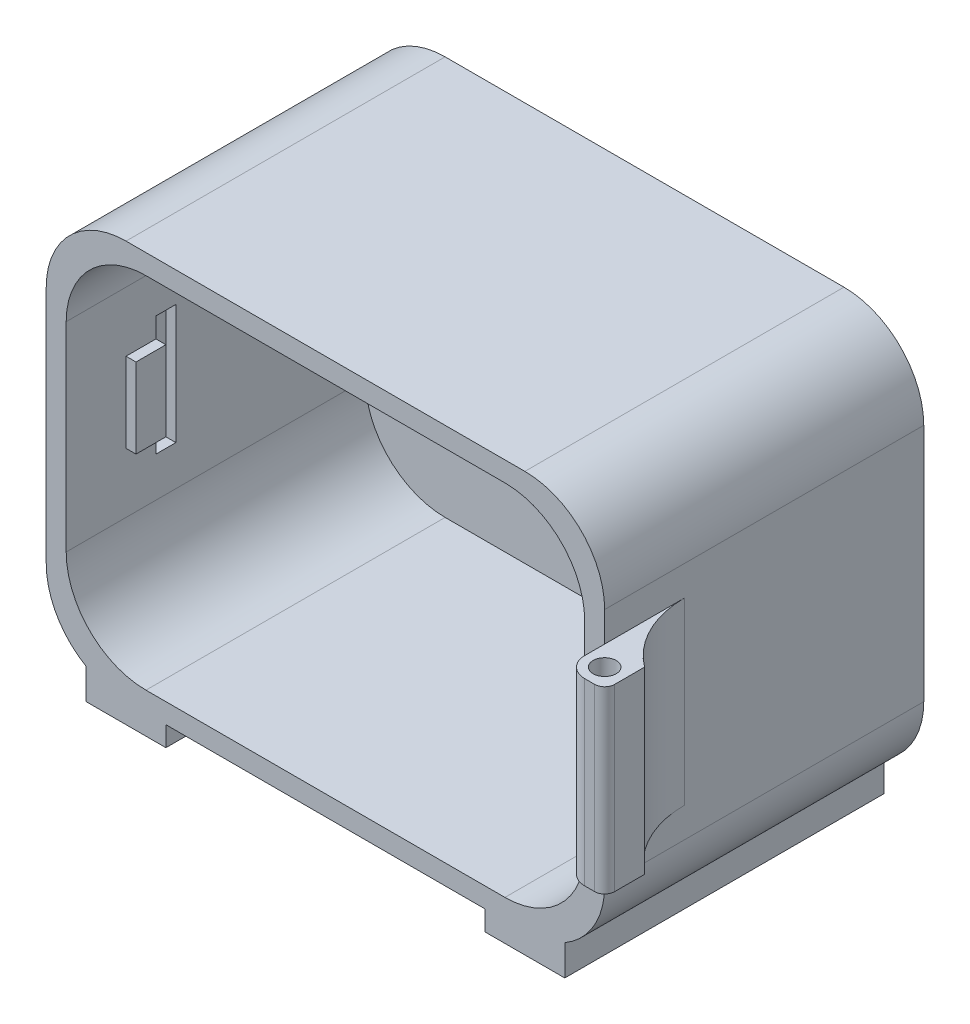
from build123d import *

# Parameters (mm, degrees)
BOSS_EXTRUDE1_DEPTH             = 95.25
BOSS_EXTRUDE2_DEPTH             = 6.35
SKETCH4_W                       = 25.4
SKETCH4_H                       = 101.6
BOSS_EXTRUDE3_DEPTH             = 6.35
BOSS_EXTRUDE3_DIRECTION_2_REACH = 187.35
BOSS_EXTRUDE5_DEPTH             = 28.575
BOSS_EXTRUDE5_DEPTH_BACK        = 28.575
SKETCH5_R                       = 3.675
FILLET1_R                       = 3.175
SKETCH8_W                       = 6.35
SKETCH8_H                       = 38.1
CUT_EXTRUDE1_DEPTH              = 3.175
SKETCH10_W                      = 9.525
SKETCH10_H                      = 25.4
BOSS_EXTRUDE6_DEPTH             = 3.175
SKETCH11_R                      = 44.824096384
CUT_EXTRUDE4_DEPTH              = 1.5875
FILLET2_R                       = 6.35


with BuildPart() as part:
    # Sketch1 → Boss-Extrude1 (new body)
    with BuildSketch(Plane.XY):
        with BuildLine():
            Line((-63.5, 63.5), (63.5, 63.5))
            ThreePointArc((63.5, 63.5), (81.460512242, 56.060512242), (88.9, 38.1))
            Line((88.9, 38.1), (88.9, -38.1))
            ThreePointArc((88.9, -38.1), (81.460512242, -56.060512242), (63.5, -63.5))
            Line((63.5, -63.5), (-63.5, -63.5))
            ThreePointArc((-63.5, -63.5), (-81.460512242, -56.060512242), (-88.9, -38.1))
            Line((-88.9, -38.1), (-88.9, 38.1))
            ThreePointArc((-88.9, 38.1), (-81.460512242, 56.060512242), (-63.5, 63.5))
        make_face()
        with BuildLine():
            Line((-82.55, 31.75), (-82.55, -31.75))
            ThreePointArc((-82.55, -31.75), (-75.110512242, -49.710512242), (-57.15, -57.15))
            Line((-57.15, -57.15), (57.15, -57.15))
            ThreePointArc((57.15, -57.15), (75.110512242, -49.710512242), (82.55, -31.75))
            Line((82.55, -31.75), (82.55, 31.75))
            ThreePointArc((82.55, 31.75), (75.110512242, 49.710512242), (57.15, 57.15))
            Line((57.15, 57.15), (-57.15, 57.15))
            ThreePointArc((-57.15, 57.15), (-75.110512242, 49.710512242), (-82.55, 31.75))
        make_face(mode=Mode.SUBTRACT)
    extrude(amount=-BOSS_EXTRUDE1_DEPTH)

    # Sketch2 → Boss-Extrude2 (add)
    with BuildSketch(Plane(origin=(0, 0, -95.25), x_dir=(-1, 0, 0), z_dir=(0, 0, -1))):
        with BuildLine():
            Line((-63.5, 63.5), (63.5, 63.5))
            ThreePointArc((63.5, 63.5), (81.460512242, 56.060512242), (88.9, 38.1))
            Line((88.9, 38.1), (88.9, -38.1))
            ThreePointArc((88.9, -38.1), (81.460512242, -56.060512242), (63.5, -63.5))
            Line((63.5, -63.5), (-63.5, -63.5))
            ThreePointArc((-63.5, -63.5), (-81.460512242, -56.060512242), (-88.9, -38.1))
            Line((-88.9, -38.1), (-88.9, 38.1))
            ThreePointArc((-88.9, 38.1), (-81.460512242, 56.060512242), (-63.5, 63.5))
        make_face()
    extrude(amount=BOSS_EXTRUDE2_DEPTH)

    # Sketch4 → Boss-Extrude3 (add)
    with BuildSketch(Plane.XZ.offset(63.5)):
        with Locations((-63.5, -50.8)):
            Rectangle(SKETCH4_W, SKETCH4_H)
        with Locations((63.5, -50.8)):
            Rectangle(SKETCH4_W, SKETCH4_H)
    extrude(amount=BOSS_EXTRUDE3_DEPTH)

    # Sketch4 → Boss-Extrude3 direction 2 (add, up to next)
    with BuildSketch(Plane.XZ.offset(63.5), mode=Mode.PRIVATE) as boss_extrude3_direction_2_sk1:
        with Locations((-63.5, -50.8)):
            Rectangle(SKETCH4_W, SKETCH4_H)
    boss_extrude3_direction_2_tool1 = extrude(boss_extrude3_direction_2_sk1.sketch, amount=-BOSS_EXTRUDE3_DIRECTION_2_REACH, mode=Mode.PRIVATE) - part.part
    # Sketch4 → Boss-Extrude3 direction 2 (add, up to next)
    with BuildSketch(Plane.XZ.offset(63.5), mode=Mode.PRIVATE) as boss_extrude3_direction_2_sk2:
        with Locations((63.5, -50.8)):
            Rectangle(SKETCH4_W, SKETCH4_H)
    boss_extrude3_direction_2_tool2 = extrude(boss_extrude3_direction_2_sk2.sketch, amount=-BOSS_EXTRUDE3_DIRECTION_2_REACH, mode=Mode.PRIVATE) - part.part
    add(boss_extrude3_direction_2_tool1.solids().sort_by_distance((-63.5, -63.5, -50.8))[0])
    add(boss_extrude3_direction_2_tool2.solids().sort_by_distance((63.5, -63.5, -50.8))[0])

    # Sketch5 → Boss-Extrude5 (add, two sides: drawn at the far end of the back side and taken through both)
    with BuildSketch(Plane(origin=(0, 0, 0), x_dir=(1, 0, 0), z_dir=(0, 1, 0)).offset(-BOSS_EXTRUDE5_DEPTH_BACK)):
        with BuildLine():
            ThreePointArc((101.6, 0), (92.251936686, 11.200968343), (88.9, 25.4))
            Line((88.9, 25.4), (88.9, 0))
            Line((88.9, 0), (88.9, -12.7))
            Line((88.9, -12.7), (101.6, -12.7))
            Line((101.6, -12.7), (101.6, 0))
        make_face()
        with Locations((95.25, -6.35)):
            Circle(SKETCH5_R, mode=Mode.SUBTRACT)
    extrude(amount=BOSS_EXTRUDE5_DEPTH + BOSS_EXTRUDE5_DEPTH_BACK)

    # Fillet1
    fillet1_edges = [part.edges().sort_by_distance(p)[0] for p in [
        (101.6, 0, 12.7),
    ]]
    fillet(fillet1_edges, radius=FILLET1_R)

    # Sketch8 → Cut-Extrude1 (cut)
    with BuildSketch(Plane(origin=(-82.55, 0, 0), x_dir=(0, 0, -1), z_dir=(1, 0, 0))):
        with Locations((31.75, 0)):
            Rectangle(SKETCH8_W, SKETCH8_H)
    extrude(amount=-CUT_EXTRUDE1_DEPTH, mode=Mode.SUBTRACT)

    # Sketch10 → Boss-Extrude6 (add)
    with BuildSketch(Plane(origin=(-82.55, 0, 0), x_dir=(0, 0, -1), z_dir=(1, 0, 0))):
        with Locations((23.8125, 0)):
            Rectangle(SKETCH10_W, SKETCH10_H)
    extrude(amount=BOSS_EXTRUDE6_DEPTH)

    # Sketch11 → Cut-Extrude4 (cut)
    # profile 1 of 2: a face of its own
    with BuildSketch(Plane(origin=(0, 0, -101.6), x_dir=(-1, 0, 0), z_dir=(0, 0, -1))):
        with Locations((0, 3.175)):
            Circle(SKETCH11_R)
        with BuildLine():
            Line((-8.558023622, 38.277554278), (9.414722671, 38.277554278))
            Line((9.414722671, 38.277554278), (12.376141094, 30.516595652))
            Line((12.376141094, 30.516595652), (6.555422124, 30.516595652))
            ThreePointArc((6.555422124, 30.516595652), (-1.070912861, 28.84594719), (6.555422124, 27.175298727))
            Line((6.555422124, 27.175298727), (13.309498487, 27.175298727))
            Line((13.309498487, 27.175298727), (31.249567059, -24.733260338))
            Line((31.249567059, -24.733260338), (24.338229167, -24.733260338))
            Line((24.338229167, -24.733260338), (24.338229167, -18.851270642))
            ThreePointArc((24.338229167, -18.851270642), (22.794206871, -11.23122082), (21.250184576, -18.851270642))
            Line((21.250184576, -18.851270642), (21.250184576, -24.733260338))
            Line((21.250184576, -24.733260338), (16.103443592, -24.733260338))
            Line((16.103443592, -24.733260338), (16.103443592, -18.851270642))
            ThreePointArc((16.103443592, -18.851270642), (14.239792343, -11.126064356), (12.376141094, -18.851270642))
            Line((12.376141094, -18.851270642), (12.376141094, -24.733260338))
            Line((12.376141094, -24.733260338), (10.515553381, -24.733260338))
            Line((10.515553381, -24.733260338), (8.456856988, -17.527822961))
            Line((8.456856988, -17.527822961), (-7.424515191, -17.527822961))
            Line((-7.424515191, -17.527822961), (-9.630261327, -24.733260338))
            Line((-9.630261327, -24.733260338), (-30.070175519, -24.733260338))
            Line((-30.070175519, -24.733260338), (-27.864429383, -17.527822961))
            Line((-27.864429383, -17.527822961), (-20.953091491, -17.527822961))
            ThreePointArc((-20.953091491, -17.527822961), (-12.798886715, -15.836750923), (-20.953091491, -14.145678885))
            Line((-20.953091491, -14.145678885), (-26.540981702, -14.145678885))
            Line((-26.540981702, -14.145678885), (-8.558023622, 38.277554278))
        make_face(mode=Mode.SUBTRACT)
    # profile 2 of 2: a face of its own
    with BuildSketch(Plane(origin=(0, 0, -101.6), x_dir=(-1, 0, 0), z_dir=(0, 0, -1))):
        Polygon((0.754840192, 15.029545848), (-4.852280703, -6.689071297), (6.018431459, -6.689071297), align=None)
    extrude(amount=-CUT_EXTRUDE4_DEPTH, mode=Mode.SUBTRACT)

    # Fillet2
    fillet2_edges = [part.edges().sort_by_distance(p)[0] for p in [
        (88.9, 0, 12.7),
    ]]
    fillet(fillet2_edges, radius=FILLET2_R)


solid = part.part
